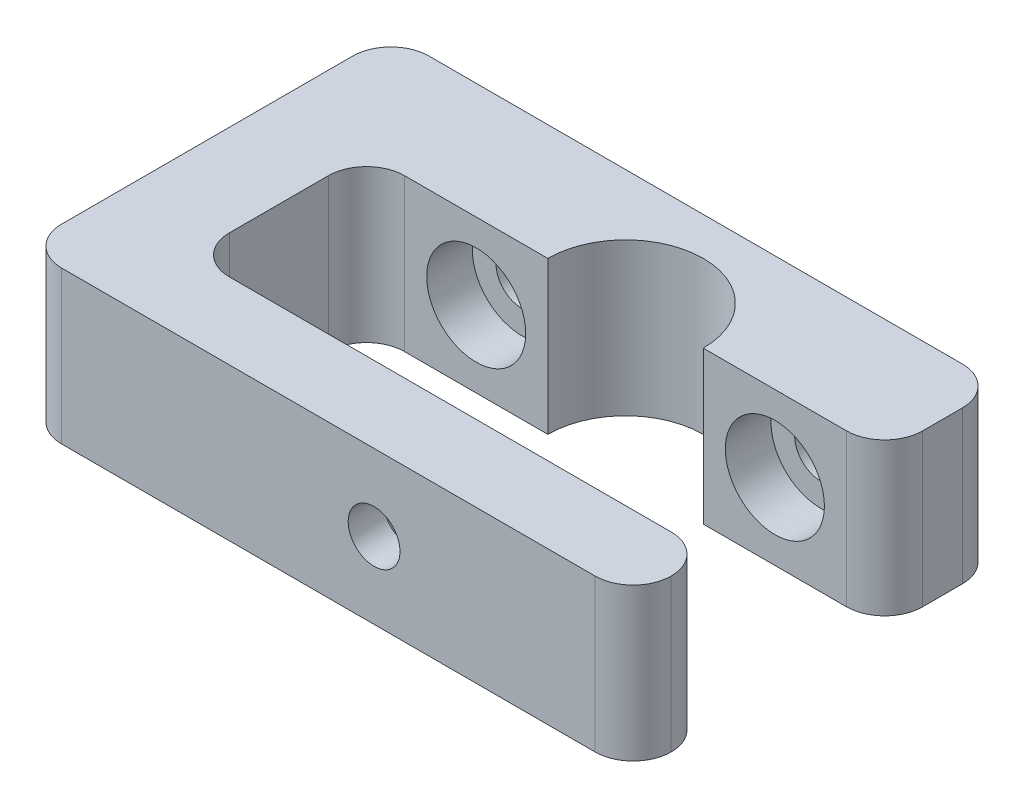
from build123d import *

# Parameters (mm, degrees)
BOSS_EXTRUDE1_DEPTH            = 10
FILLET1_R                      = 2.5
CUT_EXTRUDE1_DEPTH             = 2.7
CBORE_FOR_M3_SHCS1_D           = 3.4
CBORE_FOR_M3_SHCS1_DEPTH       = 7.6
CBORE_FOR_M3_SHCS1_CBORE_D     = 6.5
CBORE_FOR_M3_SHCS1_CBORE_DEPTH = 3
M3_CLEARANCE_HOLE1_D           = 3.4
M3_CLEARANCE_HOLE1_DEPTH       = 2.3


with BuildPart() as part:
    # Sketch1 → Boss-Extrude1 (new body)
    with BuildSketch(Plane(origin=(0, 0, 0), x_dir=(1, 0, 0), z_dir=(0, 1, 0))):
        with BuildLine():
            Line((5.1, 0), (17, 0))
            Line((17, 0), (17, 7.6))
            Line((17, 7.6), (-23, 7.6))
            Line((-23, 7.6), (-23, -16.5))
            Line((-23, -16.5), (17, -16.5))
            Line((17, -16.5), (17, -11.5))
            Line((17, -11.5), (-17, -11.5))
            Line((-17, -11.5), (-17, 0))
            Line((-17, 0), (-5.1, 0))
            ThreePointArc((-5.1, 0), (0, 5.1), (5.1, 0))
        make_face()
    extrude(amount=BOSS_EXTRUDE1_DEPTH)

    # Fillet1
    fillet1_edges = [part.edges().sort_by_distance(p)[0] for p in [
        (-17, 5, 0),
        (-17, 5, 11.5),
        (17, 5, 11.5),
        (17, 5, 16.5),
        (-23, 5, 16.5),
        (-23, 5, -7.6),
        (17, 5, -7.6),
        (17, 5, 0),
    ]]
    fillet(fillet1_edges, radius=FILLET1_R - 0.0001)  # a hair under: the kernel refuses the full size

    # Sketch3 → Cut-Extrude1 (cut)
    with BuildSketch(Plane(origin=(0, 0, 11.5), x_dir=(-1, 0, 0), z_dir=(0, 0, -1))):
        Polygon((3.3, 5), (1.65, 7.857883832), (-1.65, 7.857883832), (-3.3, 5), (-1.65, 2.142116168), (1.65, 2.142116168), align=None)
    extrude(amount=-CUT_EXTRUDE1_DEPTH, mode=Mode.SUBTRACT)

    # CBORE for M3 SHCS1
    with Locations(Plane.XY):
        with Locations((-9.8, 5), (9.8, 5)):
            CounterBoreHole(CBORE_FOR_M3_SHCS1_D / 2, CBORE_FOR_M3_SHCS1_CBORE_D / 2, CBORE_FOR_M3_SHCS1_CBORE_DEPTH, depth=CBORE_FOR_M3_SHCS1_DEPTH)

    # M3 Clearance Hole1
    with Locations(Plane(origin=(0, 0, 14.2), x_dir=(-1, 0, 0), z_dir=(0, 0, -1))):
        with Locations((0, 5)):
            Hole(M3_CLEARANCE_HOLE1_D / 2, depth=M3_CLEARANCE_HOLE1_DEPTH)


solid = part.part
